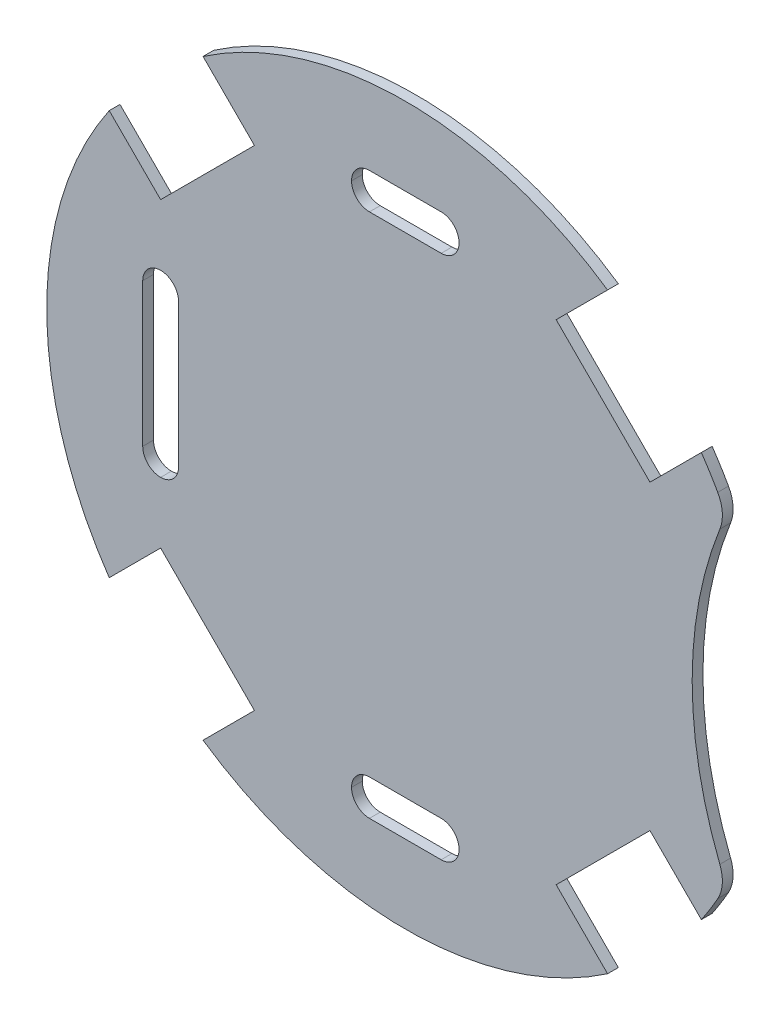
from build123d import *

# Parameters (mm, degrees)
CROQUIS1_R              = 100
SALIENTE_EXTRUIR1_DEPTH = 3
CROQUIS3_R              = 110
CORTAR_EXTRUIR1_DEPTH   = 3
REDONDEO1_R             = 10
CORTAR_EXTRUIR2_DEPTH   = 142.453172607
CROQUIS6_W              = 10
CROQUIS6_H              = 50
CROQUIS6_W_2            = 30
CROQUIS6_H_2            = 10
CORTAR_EXTRUIR4_DEPTH   = 10
REDONDEO3_R             = 5


with BuildPart() as part:
    # Croquis1 → Saliente-Extruir1 (new body)
    with BuildSketch(Plane.XY):
        Circle(CROQUIS1_R)
    extrude(amount=SALIENTE_EXTRUIR1_DEPTH)

    # Croquis3 → Cortar-Extruir1 (cut)
    with BuildSketch(Plane.XY.offset(3)):
        with Locations((190, 0)):
            Circle(CROQUIS3_R)
    extrude(amount=-CORTAR_EXTRUIR1_DEPTH, mode=Mode.SUBTRACT)

    # Redondeo1
    redondeo1_edges = [part.edges().sort_by_distance(p)[0] for p in [
        (89.473684211, -44.659375654, 1.5),
        (89.473684211, 44.659375654, 1.5),
    ]]
    fillet(redondeo1_edges, radius=REDONDEO1_R)

    # Croquis4 → Cortar-Extruir2 (cut, through all)
    with BuildSketch(Plane.XY.offset(3)):
        Polygon((-57.629202667, -83.792153571), (-83.792153571, -57.629202667), (-68.235804385, -42.072853481), (-42.072853481, -68.235804385), align=None)
        Polygon((-57.629202667, 83.792153571), (-42.072853481, 68.235804385), (-68.235804385, 42.072853481), (-83.792153571, 57.629202667), align=None)
        Polygon((83.792153571, 57.629202667), (68.235804385, 42.072853481), (42.072853481, 68.235804385), (57.629202667, 83.792153571), align=None)
        Polygon((57.629202667, -83.792153571), (42.072853481, -68.235804385), (68.235804385, -42.072853481), (83.792153571, -57.629202667), align=None)
    extrude(amount=-CORTAR_EXTRUIR2_DEPTH, mode=Mode.SUBTRACT)

    # Croquis6 → Cortar-Extruir4 (cut)
    with BuildSketch(Plane.XY.offset(3)):
        with Locations((-68.235804385, 0)):
            Rectangle(CROQUIS6_W, CROQUIS6_H)
        with Locations((0, 73.24)):
            Rectangle(CROQUIS6_W_2, CROQUIS6_H_2)
        with Locations((0, -73.24)):
            Rectangle(CROQUIS6_W_2, CROQUIS6_H_2)
    extrude(amount=-CORTAR_EXTRUIR4_DEPTH, mode=Mode.SUBTRACT)

    # Redondeo3
    redondeo3_edges = [part.edges().sort_by_distance(p)[0] for p in [
        (15, -78.24, 1.5),
        (-15, -78.24, 1.5),
        (15, -68.24, 1.5),
        (-15, -68.24, 1.5),
        (-73.235804385, -25, 1.5),
        (-63.235804385, -25, 1.5),
        (-73.235804385, 25, 1.5),
        (-63.235804385, 25, 1.5),
        (-15, 68.24, 1.5),
        (15, 68.24, 1.5),
        (-15, 78.24, 1.5),
        (15, 78.24, 1.5),
    ]]
    fillet(redondeo3_edges, radius=REDONDEO3_R - 0.0001)  # a hair under: the kernel refuses the full size


solid = part.part
